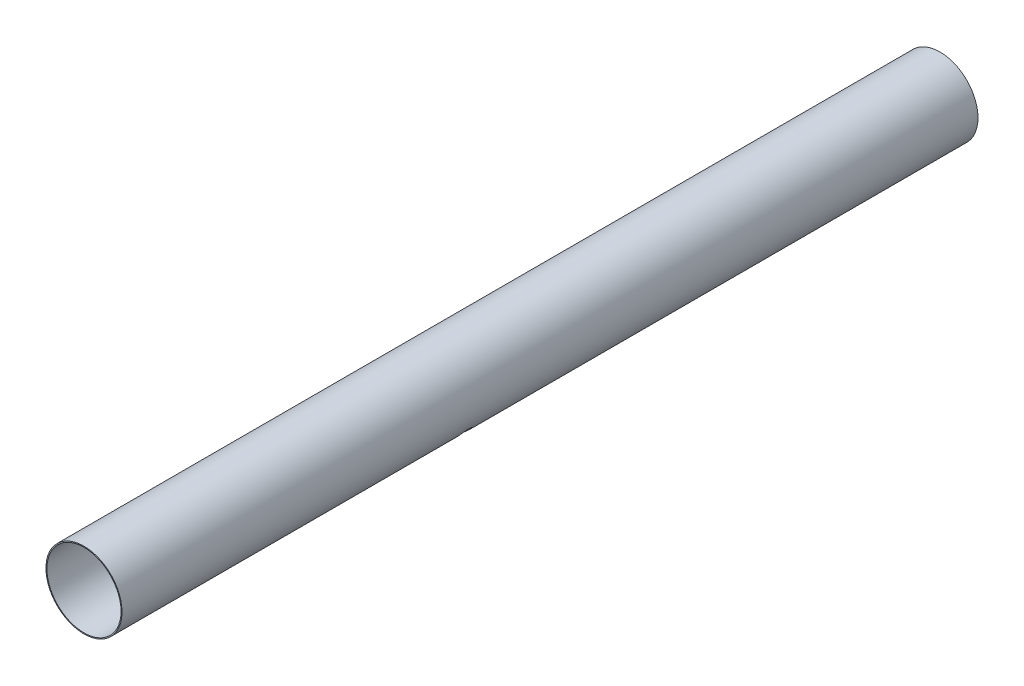
from build123d import *

# Parameters (mm, degrees)
SKETCH1_R           = 78.2
SKETCH1_R_2         = 76.2
BOSS_EXTRUDE1_DEPTH = 1760
SKETCH5_R           = 15
CUT_EXTRUDE2_DEPTH  = 1764.471145213


with BuildPart() as part:
    # Sketch1 → Boss-Extrude1 (new body)
    with BuildSketch(Plane.XY):
        Circle(SKETCH1_R)
        Circle(SKETCH1_R_2, mode=Mode.SUBTRACT)
    extrude(amount=BOSS_EXTRUDE1_DEPTH)

    # Sketch5 → Cut-Extrude2 (cut, through all)
    with BuildSketch(Plane(origin=(0, 0, 0), x_dir=(0, 0, -1), z_dir=(0.7071067811865489, -0.7071067811865462, 0))):
        with Locations((-1034.89, 0)):
            Circle(SKETCH5_R)
    extrude(amount=CUT_EXTRUDE2_DEPTH, mode=Mode.SUBTRACT)


solid = part.part
